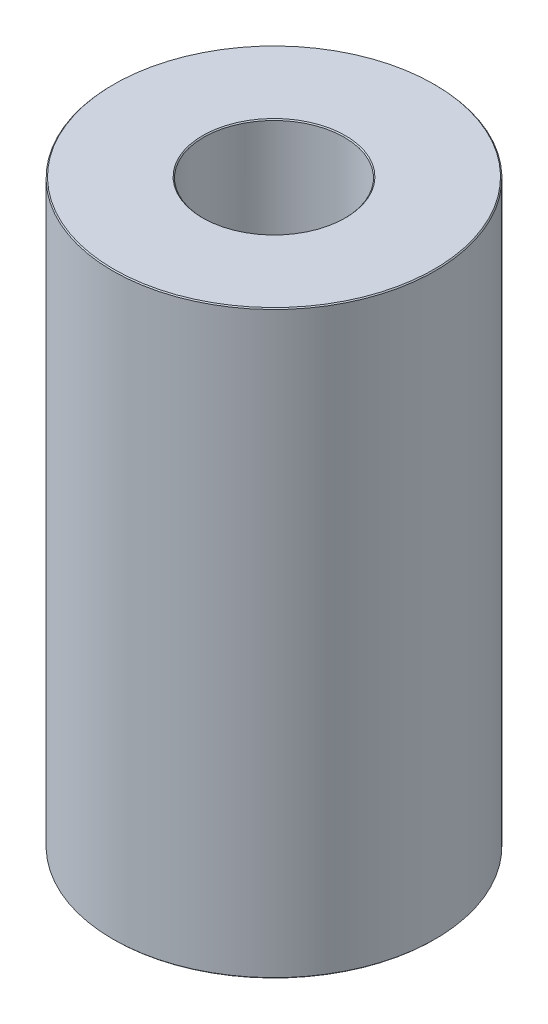
from build123d import *

# Parameters (mm, degrees)
SKETCH1_R           = 60
BOSS_EXTRUDE1_DEPTH = 216.148202147
SKETCH2_R           = 26.204864349
CUT_EXTRUDE1_DEPTH  = 233.206901903
CHAMFER1_SIZE       = 0.36893686


with BuildPart() as part:
    # Sketch1 → Boss-Extrude1 (new body)
    with BuildSketch(Plane(origin=(0, 0, 0), x_dir=(1, 0, 0), z_dir=(0, 1, 0))):
        Circle(SKETCH1_R)
    extrude(amount=BOSS_EXTRUDE1_DEPTH)

    # Sketch2 → Cut-Extrude1 (cut, through all)
    with BuildSketch(Plane(origin=(0, 0, 0), x_dir=(1, 0, 0), z_dir=(0, 1, 0))):
        Circle(SKETCH2_R)
    extrude(amount=CUT_EXTRUDE1_DEPTH, mode=Mode.SUBTRACT)

    # Chamfer1
    chamfer1_edges = [part.edges().sort_by_distance(p)[0] for p in [
        (-26.204864349, 216.148202147, 0),
        (-26.204864349, 0, 0),
        (-60, 0, 0),
        (-60, 216.148202147, 0),
    ]]
    chamfer(chamfer1_edges, length=CHAMFER1_SIZE)


solid = part.part
